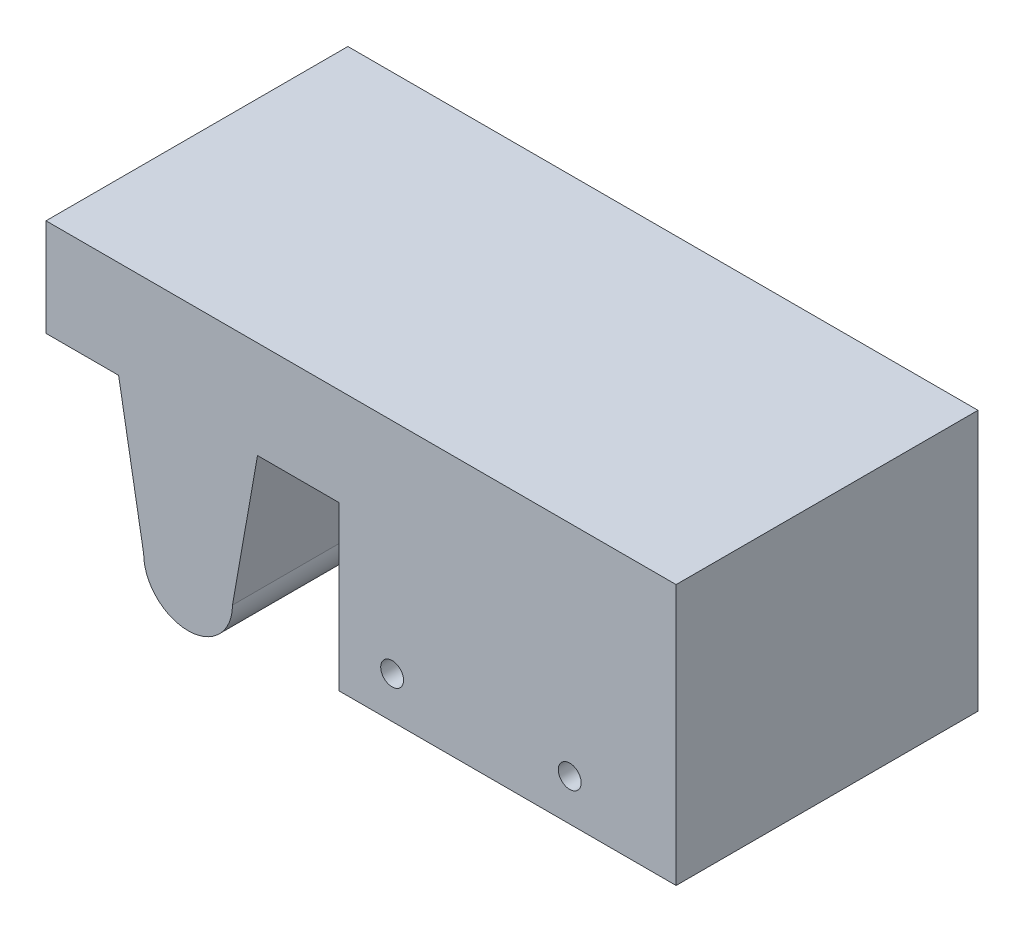
from build123d import *
from build123d.topology import SkipClean

# Parameters (mm, degrees)
SKETCH1_W             = 48
SKETCH1_H             = 53
BOSS_EXTRUDE1_DEPTH   = 10
SKETCH2_W             = 48
SKETCH2_H             = 5.616325
BOSS_EXTRUDE2_DEPTH   = 33.1917878
SKETCH4_W             = 4
SKETCH4_H             = 10
BOSS_EXTRUDE4_DEPTH   = 40
SKETCH5_W             = 48
SKETCH5_H             = 10.8609375
BOSS_EXTRUDE5_DEPTH   = 23.1917878
SKETCH6_W             = 48
SKETCH6_H             = 5
BOSS_EXTRUDE6_DEPTH   = 42.3
SKETCH7_W             = 12.8082122
SKETCH7_H             = 16.4772625
BOSS_EXTRUDE7_DEPTH   = 48
CUT_EXTRUDE1_REACH    = 84.426
SKETCH8_R             = 11.5
SKETCH8_R_2           = 2
FILLET1_R             = 10
FILLET2_R             = 4
SKETCH9_W             = 5
SKETCH9_H             = 16.4772625
BOSS_EXTRUDE9_DEPTH   = 48
CUT_EXTRUDE2_DEPTH    = 88.252507127
SKETCH11_W            = 51
SKETCH11_H            = 16.4772625
BOSS_EXTRUDE10_DEPTH  = 49.45
BOSS_EXTRUDE11_DEPTH  = 46
SKETCH16_W            = 47.95
SKETCH16_H            = 51
BOSS_EXTRUDE14_DEPTH  = 2.55
SKETCH14_W            = 5
SKETCH14_H            = 42.3
BOSS_EXTRUDE13_DEPTH  = 1.5
SKETCH17_W            = 51
SKETCH17_H            = 19.0272625
BOSS_EXTRUDE15_DEPTH  = 9
BOSS_EXTRUDE16_DEPTH  = 25
SKETCH19_R            = 1.9304
CUT_EXTRUDE3_DEPTH    = 125.404890183
MIRROR2_START         = 33.1917878
MIRROR2_DEPTH         = 51
MIRROR2_START_2       = 76.1917878
MIRROR2_2_OUTLINE_W   = 47.95
MIRROR2_2_OUTLINE_H   = 25
MIRROR2_2_OUTLINE_R   = 1.9304
MIRROR2_2_DEPTH       = 8
MIRROR2_3_OUTLINE_W   = 45
MIRROR2_3_OUTLINE_H   = 42.3
MIRROR2_3_OUTLINE_R   = 2
MIRROR2_3_OUTLINE_R_2 = 11.5
MIRROR2_3_DEPTH       = 5
SKETCH20_W            = 103.287975037
SKETCH20_H            = 97.84889924
CUT_EXTRUDE4_DEPTH    = 144.929961559
SKETCH21_W            = 49.5
SKETCH21_H            = 42.3
CUT_EXTRUDE5_DEPTH    = 128.391431036
SKETCH24_R            = 7.5
BOSS_EXTRUDE18_DEPTH  = 45
BOSS_EXTRUDE19_DEPTH  = 29


# Read off the part's stored shape, not the designer's step: Mirror2
with BuildPart() as part:
    # Sketch1 → Boss-Extrude1 (new body)
    with BuildSketch(Plane.XY):
        with Locations((24, 26.5)):
            Rectangle(SKETCH1_W, SKETCH1_H)
    extrude(amount=BOSS_EXTRUDE1_DEPTH)

    # Sketch2 → Boss-Extrude2 (add)
    with BuildSketch(Plane(origin=(0, 0, 0), x_dir=(-1, 0, 0), z_dir=(0, 0, -1))):
        with Locations((-24, -2.8081625)):
            Rectangle(SKETCH2_W, SKETCH2_H)
    extrude(amount=-BOSS_EXTRUDE2_DEPTH)

    # Sketch4 → Boss-Extrude4 (add)
    with BuildSketch(Plane.XY.offset(10)):
        with Locations((2, 48)):
            Rectangle(SKETCH4_W, SKETCH4_H)
        with Locations((46, 48)):
            Rectangle(SKETCH4_W, SKETCH4_H)
    extrude(amount=BOSS_EXTRUDE4_DEPTH)

    # Sketch5 → Boss-Extrude5 (add)
    with BuildSketch(Plane.XY.offset(10)):
        with Locations((24, 5.43046875)):
            Rectangle(SKETCH5_W, SKETCH5_H)
    extrude(amount=BOSS_EXTRUDE5_DEPTH)

    # Sketch6 → Boss-Extrude6 (add)
    with BuildSketch(Plane.XZ.offset(5.616325)):
        with Locations((24, 30.6917878)):
            Rectangle(SKETCH6_W, SKETCH6_H)
    extrude(amount=BOSS_EXTRUDE6_DEPTH)

    # Sketch7 → Boss-Extrude7 (add)
    with BuildSketch(Plane.ZY):
        with Locations((-6.4041061, 2.62230625)):
            Rectangle(SKETCH7_W, SKETCH7_H)
    extrude(amount=-BOSS_EXTRUDE7_DEPTH)

    # Sketch8 → Cut-Extrude1 (cut, up to next)
    with BuildSketch(Plane(origin=(0, 0, 28.1917878), x_dir=(-1, 0, 0), z_dir=(0, 0, -1)), mode=Mode.PRIVATE) as cut_extrude1_sk1:
        with Locations((-24, -26.616325)):
            Circle(SKETCH8_R)
    cut_extrude1_tool1 = extrude(cut_extrude1_sk1.sketch, amount=-CUT_EXTRUDE1_REACH, mode=Mode.PRIVATE) & part.part
    # Sketch8 → Cut-Extrude1 (cut, up to next)
    with BuildSketch(Plane(origin=(0, 0, 28.1917878), x_dir=(-1, 0, 0), z_dir=(0, 0, -1)), mode=Mode.PRIVATE) as cut_extrude1_sk2:
        with Locations((-39.5, -11.116325)):
            Circle(SKETCH8_R_2)
    cut_extrude1_tool2 = extrude(cut_extrude1_sk2.sketch, amount=-CUT_EXTRUDE1_REACH, mode=Mode.PRIVATE) & part.part
    # Sketch8 → Cut-Extrude1 (cut, up to next)
    with BuildSketch(Plane(origin=(0, 0, 28.1917878), x_dir=(-1, 0, 0), z_dir=(0, 0, -1)), mode=Mode.PRIVATE) as cut_extrude1_sk3:
        with Locations((-39.5, -42.116325)):
            Circle(SKETCH8_R_2)
    cut_extrude1_tool3 = extrude(cut_extrude1_sk3.sketch, amount=-CUT_EXTRUDE1_REACH, mode=Mode.PRIVATE) & part.part
    # Sketch8 → Cut-Extrude1 (cut, up to next)
    with BuildSketch(Plane(origin=(0, 0, 28.1917878), x_dir=(-1, 0, 0), z_dir=(0, 0, -1)), mode=Mode.PRIVATE) as cut_extrude1_sk4:
        with Locations((-8.5, -11.116325)):
            Circle(SKETCH8_R_2)
    cut_extrude1_tool4 = extrude(cut_extrude1_sk4.sketch, amount=-CUT_EXTRUDE1_REACH, mode=Mode.PRIVATE) & part.part
    # Sketch8 → Cut-Extrude1 (cut, up to next)
    with BuildSketch(Plane(origin=(0, 0, 28.1917878), x_dir=(-1, 0, 0), z_dir=(0, 0, -1)), mode=Mode.PRIVATE) as cut_extrude1_sk5:
        with Locations((-8.5, -42.116325)):
            Circle(SKETCH8_R_2)
    cut_extrude1_tool5 = extrude(cut_extrude1_sk5.sketch, amount=-CUT_EXTRUDE1_REACH, mode=Mode.PRIVATE) & part.part
    add(cut_extrude1_tool1.solids().sort_by_distance((24, -26.616325, 28.191788))[0], mode=Mode.SUBTRACT)
    add(cut_extrude1_tool2.solids().sort_by_distance((39.5, -11.116325, 28.191788))[0], mode=Mode.SUBTRACT)
    add(cut_extrude1_tool3.solids().sort_by_distance((39.5, -42.116325, 28.191788))[0], mode=Mode.SUBTRACT)
    add(cut_extrude1_tool4.solids().sort_by_distance((8.5, -11.116325, 28.191788))[0], mode=Mode.SUBTRACT)
    add(cut_extrude1_tool5.solids().sort_by_distance((8.5, -42.116325, 28.191788))[0], mode=Mode.SUBTRACT)

    # Fillet1
    fillet1_edges = [part.edges().sort_by_distance(p)[0] for p in [
        (24, 10.8609375, 0),
    ]]
    fillet(fillet1_edges, radius=FILLET1_R)

    # Fillet2
    fillet2_edges = [part.edges().sort_by_distance(p)[0] for p in [
        (2, 43, 10),
        (46, 43, 10),
    ]]
    fillet(fillet2_edges, radius=FILLET2_R)

    # Sketch9 → Boss-Extrude9 (add)
    with BuildSketch(Plane(origin=(48, 0, 0), x_dir=(0, 0, -1), z_dir=(1, 0, 0))):
        with Locations((15.3082122, 2.62230625)):
            Rectangle(SKETCH9_W, SKETCH9_H)
    extrude(amount=-BOSS_EXTRUDE9_DEPTH)

    # Sketch10 → Cut-Extrude2 (cut, through all)
    with BuildSketch(Plane(origin=(48, 0, 0), x_dir=(0, 0, -1), z_dir=(1, 0, 0))):
        Polygon((17.8082122, 10.8609375), (-33.1917878, 10.8609375), (-76.887145623, 43.902095521), (-50.794096938, 74.436514195), (27.207463492, 71.105486703), align=None)
    extrude(amount=-CUT_EXTRUDE2_DEPTH, mode=Mode.SUBTRACT)

    # Sketch11 → Boss-Extrude10 (add)
    with BuildSketch(Plane(origin=(48, 0, 0), x_dir=(0, 0, -1), z_dir=(1, 0, 0))):
        with Locations((-7.6917878, 2.62230625)):
            Rectangle(SKETCH11_W, SKETCH11_H)
    extrude(amount=BOSS_EXTRUDE10_DEPTH)

    # Sketch12 → Boss-Extrude11 (add)
    with BuildSketch(Plane(origin=(0, 0, 28.1917878), x_dir=(-1, 0, 0), z_dir=(0, 0, -1))):
        Polygon((-48, -47.916325), (-45, -47.916325), (-45, -5.616325), (-49.5, -5.616325), (-49.5, -47.916325), align=None)
    extrude(amount=BOSS_EXTRUDE11_DEPTH)

    # Sketch16 → Boss-Extrude14 (add)
    with BuildSketch(Plane.XZ.offset(5.616325)):
        with Locations((73.475, 7.6917878)):
            Rectangle(SKETCH16_W, SKETCH16_H)
    extrude(amount=BOSS_EXTRUDE14_DEPTH)

    # Sketch14 → Boss-Extrude13 (add)
    with BuildSketch(Plane(origin=(49.5, 0, 0), x_dir=(0, 0, -1), z_dir=(1, 0, 0))):
        with Locations((-30.6917878, -26.766325)):
            Rectangle(SKETCH14_W, SKETCH14_H)
    extrude(amount=-BOSS_EXTRUDE13_DEPTH)

    # Sketch17 → Boss-Extrude15 (add)
    with BuildSketch(Plane(origin=(97.45, 0, 0), x_dir=(0, 0, -1), z_dir=(1, 0, 0))):
        with Locations((-7.6917878, 1.34730625)):
            Rectangle(SKETCH17_W, SKETCH17_H)
    extrude(amount=BOSS_EXTRUDE15_DEPTH)

    # Sketch18 → Boss-Extrude16 (add)
    with BuildSketch(Plane.XZ.offset(8.166325)):
        Polygon((49.5, -17.8082122), (106.45, -17.8082122), (106.45, -9.8082122), (106.45, 33.1917878), (97.45, 33.1917878), (97.45, -9.8082122), (49.5, -9.8082122), align=None)
    extrude(amount=BOSS_EXTRUDE16_DEPTH)

    # Sketch19 → Cut-Extrude3 (cut, through all)
    with BuildSketch(Plane.XY.offset(-9.8082122)):
        with Locations((58.475, -26.166325)):
            Circle(SKETCH19_R)
        with Locations((88.475, -26.166325)):
            Circle(SKETCH19_R)
    extrude(amount=-CUT_EXTRUDE3_DEPTH, mode=Mode.SUBTRACT)

    # Mirror2 outline → Mirror2 (add)
    with BuildSketch(Plane.XY.offset(MIRROR2_START)):
        Polygon((49.5, -47.916325), (49.5, -8.166325), (97.45, -8.166325), (97.45, -33.166325), (106.45, -33.166325), (106.45, 10.8609375), (0, 10.8609375), (0, -5.616325), (45, -5.616325), (45, -47.916325), align=None)
    extrude(amount=MIRROR2_DEPTH)

    # Mirror2 2 outline → Mirror2 2 (add)
    with BuildSketch(Plane.XY.offset(MIRROR2_START_2)):
        with Locations((73.475, -20.666325)):
            Rectangle(MIRROR2_2_OUTLINE_W, MIRROR2_2_OUTLINE_H)
        with Locations((58.475, -26.166325)):
            Circle(MIRROR2_2_OUTLINE_R, mode=Mode.SUBTRACT)
        with Locations((88.475, -26.166325)):
            Circle(MIRROR2_2_OUTLINE_R, mode=Mode.SUBTRACT)
    extrude(amount=MIRROR2_2_DEPTH)

    # Mirror2 3 outline → Mirror2 3 (add)
    with SkipClean():  # the faces are left unmerged after this step: merging them gives an invalid solid
        with BuildSketch(Plane.XY.offset(MIRROR2_START)):
            with Locations((22.5, -26.766325)):
                Rectangle(MIRROR2_3_OUTLINE_W, MIRROR2_3_OUTLINE_H)
            with Locations((8.5, -42.116325)):
                Circle(MIRROR2_3_OUTLINE_R, mode=Mode.SUBTRACT)
            with Locations((39.5, -42.116325)):
                Circle(MIRROR2_3_OUTLINE_R, mode=Mode.SUBTRACT)
            with Locations((24, -26.616325)):
                Circle(MIRROR2_3_OUTLINE_R_2, mode=Mode.SUBTRACT)
            with Locations((8.5, -11.116325)):
                Circle(MIRROR2_3_OUTLINE_R, mode=Mode.SUBTRACT)
            with Locations((39.5, -11.116325)):
                Circle(MIRROR2_3_OUTLINE_R, mode=Mode.SUBTRACT)
        extrude(amount=MIRROR2_3_DEPTH)

    # Sketch20 → Cut-Extrude4 (cut, through all)
    with BuildSketch(Plane.ZY):
        with Locations((-18.452199719, -38.06351212)):
            Rectangle(SKETCH20_W, SKETCH20_H)
    extrude(amount=-CUT_EXTRUDE4_DEPTH, mode=Mode.SUBTRACT)

    # Sketch21 → Cut-Extrude5 (cut, through all)
    with BuildSketch(Plane.XY.offset(84.1917878)):
        with Locations((24.75, -26.766325)):
            Rectangle(SKETCH21_W, SKETCH21_H)
    extrude(amount=-CUT_EXTRUDE5_DEPTH, mode=Mode.SUBTRACT)



with BuildPart() as body_2:
    # Sketch24 → Boss-Extrude18 (new body)
    with BuildSketch(Plane.XY.offset(55.1917878)):
        with Locations((24, -29.616325)):
            Circle(SKETCH24_R)
    extrude(amount=-BOSS_EXTRUDE18_DEPTH)


with BuildPart() as part_1:
    add(part.part)

    add(body_2.part)  # Boss-Extrude19 merges body 2
    # Sketch25 → Boss-Extrude19 (add)
    with BuildSketch(Plane.XY.offset(55.1917878)):
        with BuildLine():
            Line((16.5, -29.616325), (12.268152463, -5.616325))
            Line((12.268152463, -5.616325), (35.731847537, -5.616325))
            Line((35.731847537, -5.616325), (31.5, -29.616325))
            ThreePointArc((31.5, -29.616325), (24, -37.116325), (16.5, -29.616325))
        make_face()
    extrude(amount=BOSS_EXTRUDE19_DEPTH)


solid = part_1.part
